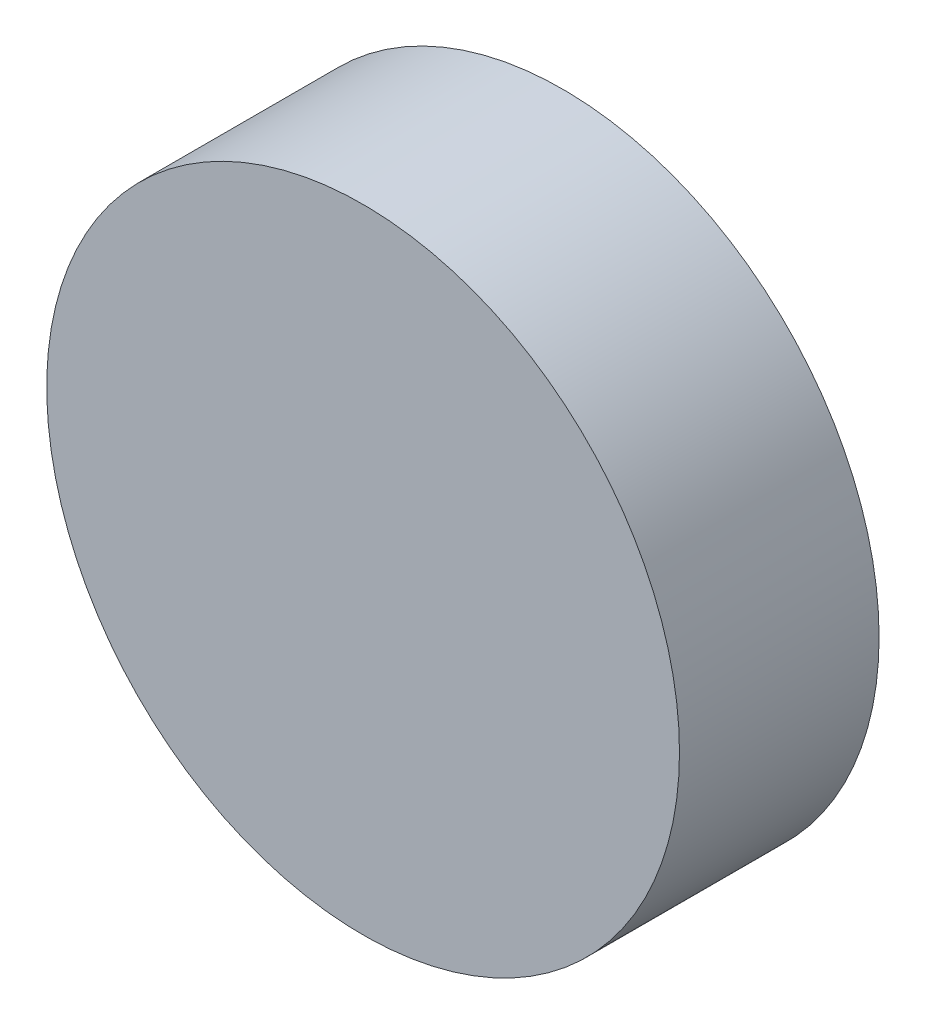
from build123d import *

# Parameters (mm, degrees)
SKETCH1_R      = 7.925
EXTRUDE1_DEPTH = 5


with BuildPart() as part:
    # Sketch1 → Extrude1 (new body)
    with BuildSketch(Plane.XY):
        Circle(SKETCH1_R)
    extrude(amount=EXTRUDE1_DEPTH)


solid = part.part
